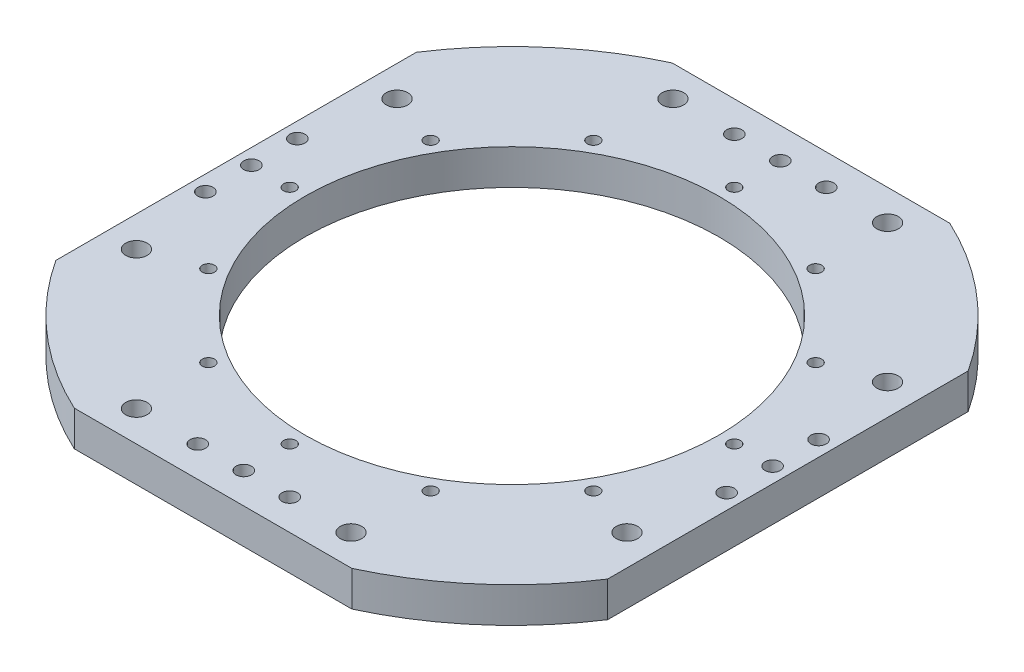
from build123d import *

# Parameters (mm, degrees)
SKETCH_1_R          = 135
SKETCH_1_R_2        = 4
EXTRUDE_1_DEPTH     = 11.5
SKETCH_2_R          = 5
SKETCH_2_R_2        = 7
CUT_EXTRUDE_1_DEPTH = 23


with BuildPart() as part:
    # 草图1 → 凸台-拉伸1 (new, symmetric)
    with BuildSketch(Plane(origin=(0, 0, 0), x_dir=(1, 0, 0), z_dir=(0, 1, 0))):
        with BuildLine():
            Line((-180, 117.579760163), (-180, -117.579760163))
            ThreePointArc((-180, -117.579760163), (-140.706503078, -162.562849359), (-90.553851381, -195))
            Line((-90.553851381, -195), (90.553851381, -195))
            ThreePointArc((90.553851381, -195), (140.706503078, -162.562849359), (180, -117.579760163))
            Line((180, -117.579760163), (180, 117.579760163))
            ThreePointArc((180, 117.579760163), (140.706503078, 162.562849359), (90.553851381, 195))
            Line((90.553851381, 195), (-90.553851381, 195))
            ThreePointArc((-90.553851381, 195), (-140.706503078, 162.562849359), (-180, 117.579760163))
        make_face()
        Circle(SKETCH_1_R, mode=Mode.SUBTRACT)
        with Locations((0, 145)):
            Circle(SKETCH_1_R_2, mode=Mode.SUBTRACT)
        with Locations((72.5, 125.573683549)):
            Circle(SKETCH_1_R_2, mode=Mode.SUBTRACT)
        with Locations((125.573683549, 72.5)):
            Circle(SKETCH_1_R_2, mode=Mode.SUBTRACT)
        with Locations((145, 0)):
            Circle(SKETCH_1_R_2, mode=Mode.SUBTRACT)
        with Locations((125.573683549, -72.5)):
            Circle(SKETCH_1_R_2, mode=Mode.SUBTRACT)
        with Locations((72.5, -125.573683549)):
            Circle(SKETCH_1_R_2, mode=Mode.SUBTRACT)
        with Locations((0, -145)):
            Circle(SKETCH_1_R_2, mode=Mode.SUBTRACT)
        with Locations((-72.5, -125.573683549)):
            Circle(SKETCH_1_R_2, mode=Mode.SUBTRACT)
        with Locations((-125.573683549, -72.5)):
            Circle(SKETCH_1_R_2, mode=Mode.SUBTRACT)
        with Locations((-145, 0)):
            Circle(SKETCH_1_R_2, mode=Mode.SUBTRACT)
        with Locations((-125.573683549, 72.5)):
            Circle(SKETCH_1_R_2, mode=Mode.SUBTRACT)
        with Locations((-72.5, 125.573683549)):
            Circle(SKETCH_1_R_2, mode=Mode.SUBTRACT)
    extrude(amount=EXTRUDE_1_DEPTH, both=True)

    # 草图2 → 切除-拉伸1 (cut)
    with BuildSketch(Plane(origin=(0, 11.5, 0), x_dir=(1, 0, 0), z_dir=(0, 1, 0))):
        with Locations((0, 175)):
            Circle(SKETCH_2_R)
        with Locations((-30, 175)):
            Circle(SKETCH_2_R)
        with Locations((-70, 175)):
            Circle(SKETCH_2_R_2)
        with Locations((70, 175)):
            Circle(SKETCH_2_R_2)
        with Locations((30, 175)):
            Circle(SKETCH_2_R)
        with Locations((-70, -175)):
            Circle(SKETCH_2_R_2)
        with Locations((-30, -175)):
            Circle(SKETCH_2_R)
        with Locations((0, -175)):
            Circle(SKETCH_2_R)
        with Locations((30, -175)):
            Circle(SKETCH_2_R)
        with Locations((70, -175)):
            Circle(SKETCH_2_R_2)
        with Locations((160, 85)):
            Circle(SKETCH_2_R_2)
        with Locations((170, 30)):
            Circle(SKETCH_2_R)
        with Locations((170, 0)):
            Circle(SKETCH_2_R)
        with Locations((160, -85)):
            Circle(SKETCH_2_R_2)
        with Locations((170, -30)):
            Circle(SKETCH_2_R)
        with Locations((-170, -30)):
            Circle(SKETCH_2_R)
        with Locations((-160, -85)):
            Circle(SKETCH_2_R_2)
        with Locations((-170, 0)):
            Circle(SKETCH_2_R)
        with Locations((-170, 30)):
            Circle(SKETCH_2_R)
        with Locations((-160, 85)):
            Circle(SKETCH_2_R_2)
    extrude(amount=-CUT_EXTRUDE_1_DEPTH, mode=Mode.SUBTRACT)


solid = part.part
